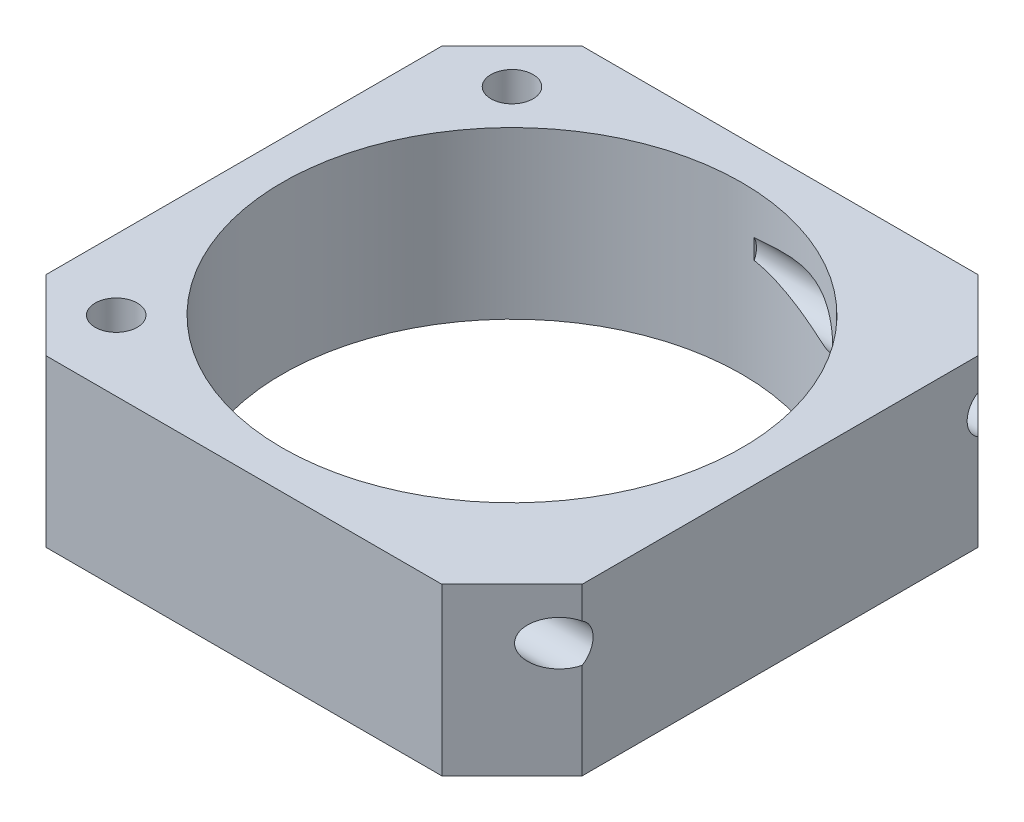
from build123d import *

# Parameters (mm, degrees)
SKETCH1_W           = 42
SKETCH1_H           = 42
SKETCH1_R           = 1.65
SKETCH1_R_2         = 18
BOSS_EXTRUDE1_DEPTH = 13
CHAMFER1_SIZE       = 5.5
SKETCH3_R           = 1.75
CUT_EXTRUDE2_DEPTH  = 20
SKETCH4_R           = 1.75
CUT_EXTRUDE3_DEPTH  = 20


with BuildPart() as part:
    # Sketch1 → Boss-Extrude1 (new body)
    with BuildSketch(Plane(origin=(0, 0, 0), x_dir=(1, 0, 0), z_dir=(0, 1, 0))):
        with Locations((21, 21)):
            Rectangle(SKETCH1_W, SKETCH1_H)
        with Locations((5.5, 36.5)):
            Circle(SKETCH1_R, mode=Mode.SUBTRACT)
        with Locations((5.5, 5.5)):
            Circle(SKETCH1_R, mode=Mode.SUBTRACT)
        with Locations((21, 21)):
            Circle(SKETCH1_R_2, mode=Mode.SUBTRACT)
    extrude(amount=BOSS_EXTRUDE1_DEPTH)

    # Chamfer1
    chamfer1_edges = [part.edges().sort_by_distance(p)[0] for p in [
        (42, 6.5, 0),
        (42, 6.5, -42),
        (0, 6.5, 0),
        (0, 6.5, -42),
    ]]
    chamfer(chamfer1_edges, length=CHAMFER1_SIZE)

    # Sketch3 → Cut-Extrude2 (cut)
    with BuildSketch(Plane(origin=(42, 0, 0), x_dir=(0, 0, -1), z_dir=(1, 0, 0))):
        with Locations((37.4, 9)):
            Circle(SKETCH3_R)
    extrude(amount=-CUT_EXTRUDE2_DEPTH, mode=Mode.SUBTRACT)

    # Sketch4 → Cut-Extrude3 (cut)
    with BuildSketch(Plane(origin=(42, 0, 0), x_dir=(0, 0, -1), z_dir=(1, 0, 0))):
        with Locations((4.6, 9)):
            Circle(SKETCH4_R)
    extrude(amount=-CUT_EXTRUDE3_DEPTH, mode=Mode.SUBTRACT)


solid = part.part
